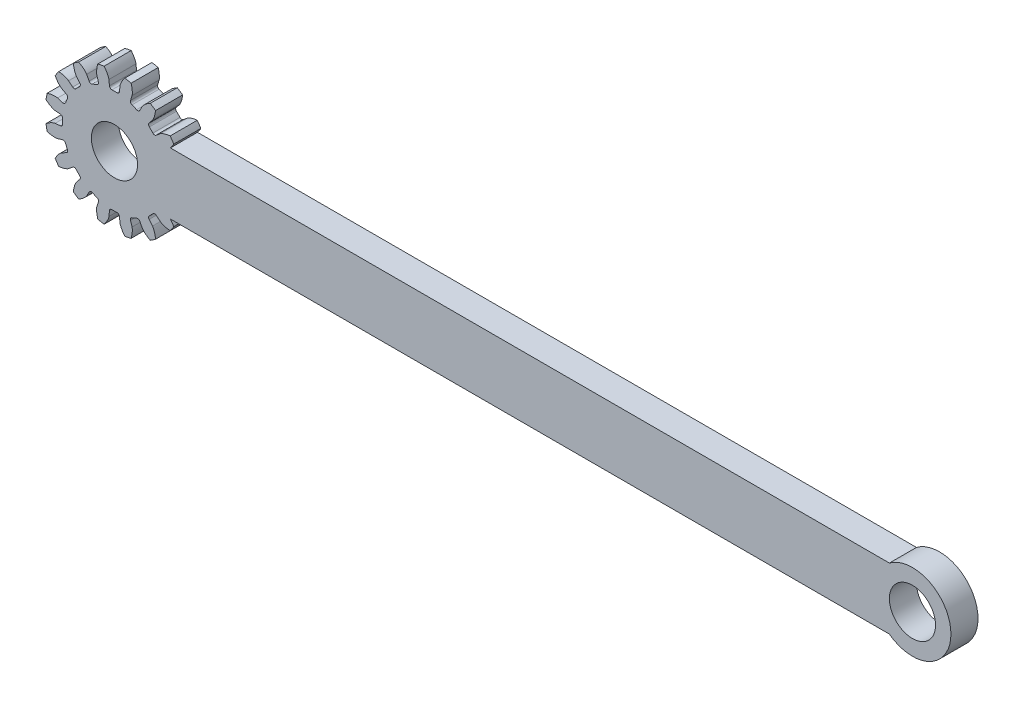
from build123d import *

# Parameters (mm, degrees)
BOSS_EXTRUDE1_DEPTH      = 5.588
CUT_EXTRUDE1_DEPTH       = 174.299858936
FILLET1_R                = 0.496244564
CIRPATTERN1_COUNT        = 16
FILLET1_OF_CIRPATTERN1_R = 0.496244564
SKETCH4_W                = 5.588
SKETCH4_H                = 12.7
BOSS_EXTRUDE2_DEPTH      = 5.08
SKETCH5_R                = 4.7625
CUT_EXTRUDE2_DEPTH       = 174.286693569


with BuildPart() as part:
    # Sketch1 → Boss-Extrude1 (new body)
    with BuildSketch(Plane.XY):
        with BuildLine():
            Line((12.798834175, -6.35), (159.919473719, -6.35))
            ThreePointArc((159.919473719, -6.35), (172.619473719, 0), (159.919473719, 6.35))
            Line((159.919473719, 6.35), (12.798834175, 6.35))
            ThreePointArc((12.798834175, 6.35), (-14.2875, 0), (12.798834175, -6.35))
        make_face()
    extrude(amount=BOSS_EXTRUDE1_DEPTH)

    # Sketch3 → Cut-Extrude1 (cut, through all)
    with BuildSketch(Plane.XY.offset(5.588)):
        with BuildLine():
            Line((10.669686204, 0.991168726), (12.242763286, 1.137300935))
            add(Edge.make_bspline(
                [(12.242763286, 1.137300935), (12.245929967, 1.137635145), (12.254799044, 1.138695353), (12.271514653, 1.141184629), (12.29870614, 1.145934011), (12.333220151, 1.152994888), (12.377662137, 1.163277963), (12.429783965, 1.17687676), (12.486802447, 1.193373916), (12.548533013, 1.212993372), (12.609834217, 1.234041125), (12.670705774, 1.256406144), (12.731081475, 1.279917576), (12.803889967, 1.309849423), (12.890730812, 1.347756353), (12.991516606, 1.39498787), (13.104943259, 1.451996931), (13.219546646, 1.513758469), (13.331477466, 1.577532772), (13.443549225, 1.64539651), (13.551258545, 1.713486182), (13.662026861, 1.787694028), (13.763711865, 1.857965741), (13.876348629, 1.940521828), (13.966876457, 2.008265101), (14.059278441, 2.081414128), (14.10408503, 2.117483013), (14.126913279, 2.136112695)],
                knots=[0, 0, 0, 0, 0, 0.005376749, 0.015083688, 0.02853182, 0.04661014, 0.064854849, 0.092110526, 0.119476176, 0.146842496, 0.174208854, 0.201574956, 0.228941013, 0.256307345, 0.307035032, 0.361767352, 0.416499661, 0.471231937, 0.525964282, 0.580696616, 0.635428982, 0.690161387, 0.744893688, 0.799626082, 0.854358407, 0.909090915, 0.909090915, 0.909090915, 0.909090915, 0.909090915], degree=4))
            ThreePointArc((14.126913279, 2.136112695), (14.2875, 0), (14.126913279, -2.136112695))
            add(Edge.make_bspline(
                [(12.242763286, -1.137300935), (12.245929967, -1.137635145), (12.254799044, -1.138695353), (12.271514653, -1.141184629), (12.29870614, -1.145934011), (12.333220151, -1.152994888), (12.377662137, -1.163277963), (12.429783965, -1.17687676), (12.486802447, -1.193373916), (12.548533013, -1.212993372), (12.609834217, -1.234041125), (12.670705774, -1.256406144), (12.731081475, -1.279917576), (12.803889967, -1.309849423), (12.890730812, -1.347756353), (12.991516606, -1.39498787), (13.104943259, -1.451996931), (13.219546646, -1.513758469), (13.331477466, -1.577532772), (13.443549225, -1.64539651), (13.551258545, -1.713486182), (13.662026861, -1.787694028), (13.763711865, -1.857965741), (13.876348629, -1.940521828), (13.966876457, -2.008265101), (14.059278441, -2.081414128), (14.10408503, -2.117483013), (14.126913279, -2.136112695)],
                knots=[0, 0, 0, 0, 0, 0.005376749, 0.015083688, 0.02853182, 0.04661014, 0.064854849, 0.092110526, 0.119476176, 0.146842496, 0.174208854, 0.201574956, 0.228941013, 0.256307345, 0.307035032, 0.361767352, 0.416499661, 0.471231937, 0.525964282, 0.580696616, 0.635428982, 0.690161387, 0.744893688, 0.799626082, 0.854358407, 0.909090915, 0.909090915, 0.909090915, 0.909090915, 0.909090915], degree=4))
            Line((12.242763286, -1.137300935), (10.669686204, -0.991168726))
            ThreePointArc((10.669686204, -0.991168726), (10.715625, 0), (10.669686204, 0.991168726))
        make_face()
    cut_extrude1 = extrude(amount=-CUT_EXTRUDE1_DEPTH, mode=Mode.SUBTRACT)

    # Fillet1
    fillet1_edges = [part.edges().sort_by_distance(p)[0] for p in [
        (10.669686204, 0.991168726, 2.794),
        (10.669686204, -0.991168726, 2.794),
    ]]
    fillet(fillet1_edges, radius=FILLET1_R)

    # CirPattern1: Cut-Extrude1 ×16 about axis
    cirpattern1_axis = Axis((0, 0, 5.588), (0, 0, 1))
    for i in range(1, CIRPATTERN1_COUNT):
        add(cut_extrude1.rotate(cirpattern1_axis, i * 360 / CIRPATTERN1_COUNT), mode=Mode.SUBTRACT)

    # Fillet1 of CirPattern1
    fillet1_of_cirpattern1_edges = [part.edges().sort_by_distance(p)[0] for p in [
        (9.478200852, 4.998832639, 2.794),
        (10.236808553, 3.167391639, 2.794),
        (6.84374534, 8.245469596, 2.794),
        (8.245469596, 6.84374534, 2.794),
        (3.167391639, 10.236808553, 2.794),
        (4.998832639, 9.478200852, 2.794),
        (-0.991168726, 10.669686204, 2.794),
        (0.991168726, 10.669686204, 2.794),
        (-4.998832639, 9.478200852, 2.794),
        (-3.167391639, 10.236808553, 2.794),
        (-8.245469596, 6.84374534, 2.794),
        (-6.84374534, 8.245469596, 2.794),
        (-10.236808553, 3.167391639, 2.794),
        (-9.478200852, 4.998832639, 2.794),
        (-10.669686204, -0.991168726, 2.794),
        (-10.669686204, 0.991168726, 2.794),
        (-9.478200852, -4.998832639, 2.794),
        (-10.236808553, -3.167391639, 2.794),
        (-6.84374534, -8.245469596, 2.794),
        (-8.245469596, -6.84374534, 2.794),
        (-3.167391639, -10.236808553, 2.794),
        (-4.998832639, -9.478200852, 2.794),
        (0.991168726, -10.669686204, 2.794),
        (-0.991168726, -10.669686204, 2.794),
        (4.998832639, -9.478200852, 2.794),
        (3.167391639, -10.236808553, 2.794),
        (8.245469596, -6.84374534, 2.794),
        (6.84374534, -8.245469596, 2.794),
        (10.236808553, -3.167391639, 2.794),
        (9.478200852, -4.998832639, 2.794),
    ]]
    fillet(fillet1_of_cirpattern1_edges, radius=FILLET1_OF_CIRPATTERN1_R)

    # Sketch4 → Boss-Extrude2 (add, symmetric)
    with BuildSketch(Plane(origin=(10.16, 0, 0), x_dir=(0, 0, -1), z_dir=(1, 0, 0))):
        with Locations((-2.794, 0)):
            Rectangle(SKETCH4_W, SKETCH4_H)
    extrude(amount=BOSS_EXTRUDE2_DEPTH, both=True)

    # Sketch5 → Cut-Extrude2 (cut, through all)
    with BuildSketch(Plane.XY.offset(5.588)):
        Circle(SKETCH5_R)
        with Locations((164.681973719, 0)):
            Circle(SKETCH5_R)
    extrude(amount=-CUT_EXTRUDE2_DEPTH, mode=Mode.SUBTRACT)


solid = part.part
